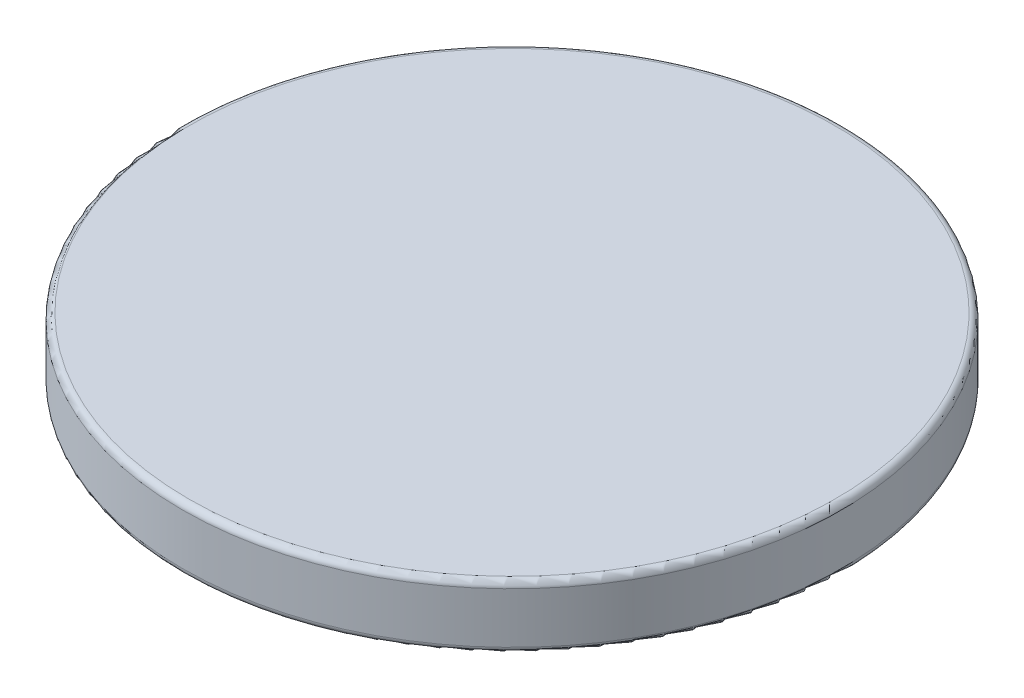
from build123d import *

# Parameters (mm, degrees)
SKETCH2_R           = 66.04
BOSS_EXTRUDE1_DEPTH = 12.7
FILLET1_R           = 1.27


with BuildPart() as part:
    # Sketch2 → Boss-Extrude1 (new body)
    with BuildSketch(Plane(origin=(0, 0, 0), x_dir=(1, 0, 0), z_dir=(0, 1, 0))):
        Circle(SKETCH2_R)
    extrude(amount=-BOSS_EXTRUDE1_DEPTH)

    # Fillet1
    fillet1_edges = [part.edges().sort_by_distance(p)[0] for p in [
        (-66.04, -12.7, 0),
        (-66.04, 0, 0),
    ]]
    fillet(fillet1_edges, radius=FILLET1_R)


solid = part.part
